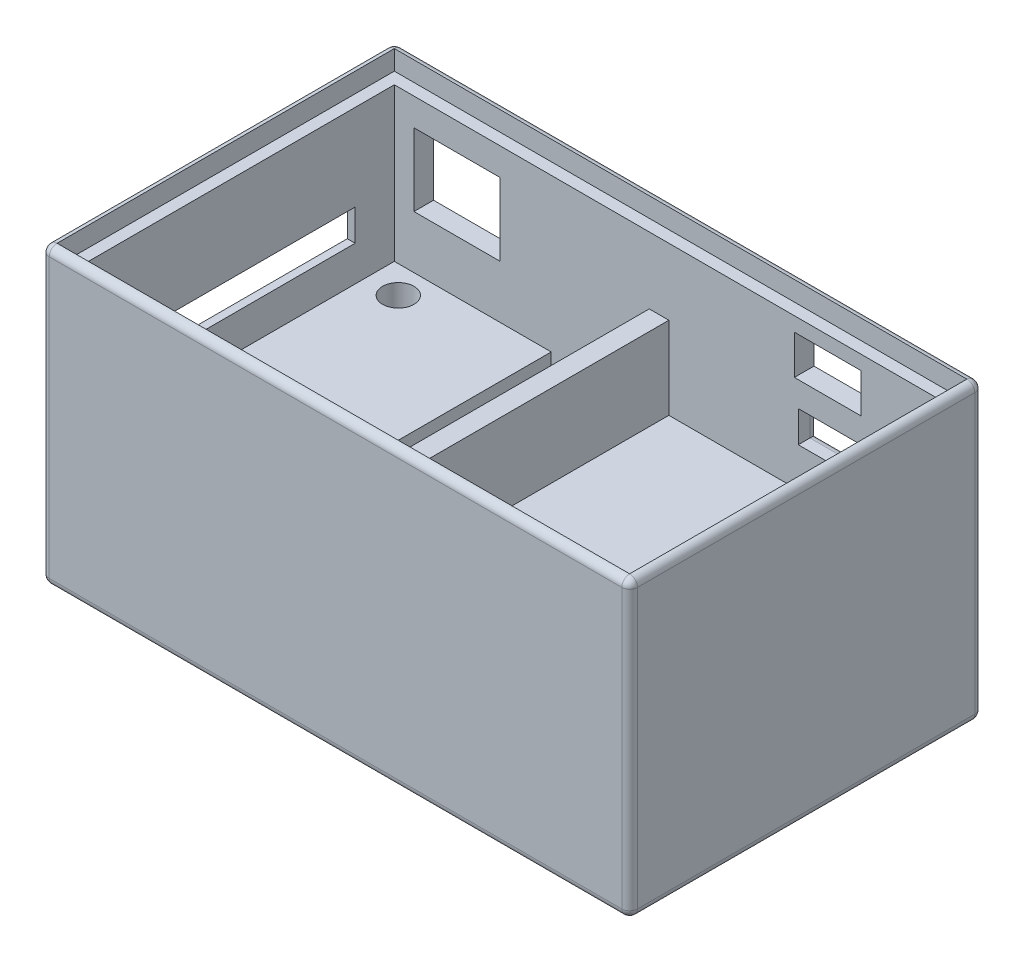
from build123d import *

# Parameters (mm, degrees)
SKETCH_2_W           = 150
SKETCH_2_H           = 90
EXTRUDE_1_DEPTH      = 75
SKETCH_3_W           = 140
SKETCH_3_H           = 80
CUT_EXTRUDE_2_DEPTH  = 72
SKETCH_6_W           = 5
SKETCH_6_H           = 80
EXTRUDE_2_DEPTH      = 50
EXTRUDE_3_REACH      = 190.016
SKETCH_8_W           = 70
SKETCH_8_H           = 3
CUT_EXTRUDE_3_REACH  = 143.863
SKETCH_9_W           = 20
SKETCH_9_H           = 10
CUT_EXTRUDE_4_REACH  = 190.016
SKETCH_10_W          = 70
SKETCH_10_H          = 26
SKETCH_11_W          = 75
SKETCH_11_H          = 30
CUT_EXTRUDE_5_DEPTH  = 5
SKETCH_12_W          = 15
SKETCH_12_H          = 8
CUT_EXTRUDE_6_DEPTH  = 5
FILLET_1_R           = 2
EXTRUDE_4_REACH      = 190.016
SKETCH_13_W          = 40
SKETCH_13_H          = 6
CUT_EXTRUDE_7_REACH  = 182.377
SKETCH_14_R          = 4
CUT_EXTRUDE_8_REACH  = 188.414
SKETCH_15_W          = 63
SKETCH_15_H          = 8
CUT_EXTRUDE_9_REACH  = 188.414
SKETCH_16_W          = 59.5
SKETCH_16_H          = 8
SKETCH_17_W          = 70
SKETCH_17_H          = 52
CUT_EXTRUDE_10_DEPTH = 3
CUT_EXTRUDE_11_REACH = 190.016
SKETCH_18_W          = 22
SKETCH_18_H          = 18.5
SKETCH_19_W          = 146
SKETCH_19_H          = 86
CUT_EXTRUDE_12_DEPTH = 5
CUT_EXTRUDE_13_REACH = 192.329
SKETCH_20_W          = 17
SKETCH_20_H          = 10


with BuildPart() as part:
    # 草图2 → 凸台-拉伸1 (new body)
    with BuildSketch(Plane(origin=(0, 0, 0), x_dir=(1, 0, 0), z_dir=(0, 1, 0))):
        with Locations((75, 45)):
            Rectangle(SKETCH_2_W, SKETCH_2_H)
    extrude(amount=EXTRUDE_1_DEPTH)

    # 草图3 → 切除-拉伸2 (cut)
    with BuildSketch(Plane(origin=(0, 75, 0), x_dir=(1, 0, 0), z_dir=(0, 1, 0))):
        with Locations((75, 45)):
            Rectangle(SKETCH_3_W, SKETCH_3_H)
    extrude(amount=-CUT_EXTRUDE_2_DEPTH, mode=Mode.SUBTRACT)

    # 草图6 → 凸台-拉伸2 (add)
    with BuildSketch(Plane(origin=(0, 3, 0), x_dir=(1, 0, 0), z_dir=(0, 1, 0))):
        with Locations((72.5, 45)):
            Rectangle(SKETCH_6_W, SKETCH_6_H)
    extrude(amount=EXTRUDE_2_DEPTH)

    # 草图8 → 凸台-拉伸3 (add, up to next)
    with BuildSketch(Plane.XY.offset(-85), mode=Mode.PRIVATE) as extrude_3_sk1:
        with Locations((110, 30.5)):
            Rectangle(SKETCH_8_W, SKETCH_8_H)
    extrude_3_tool1 = extrude(extrude_3_sk1.sketch, amount=EXTRUDE_3_REACH, mode=Mode.PRIVATE) - part.part
    add(extrude_3_tool1.solids().sort_by_distance((110, 30.5, -85))[0])

    # 草图9 → 切除-拉伸3 (cut, up to next)
    with BuildSketch(Plane.ZY.offset(-70), mode=Mode.PRIVATE) as cut_extrude_3_sk1:
        with Locations((-67, 8)):
            Rectangle(SKETCH_9_W, SKETCH_9_H)
    cut_extrude_3_tool1 = extrude(cut_extrude_3_sk1.sketch, amount=-CUT_EXTRUDE_3_REACH, mode=Mode.PRIVATE) & part.part
    add(cut_extrude_3_tool1.solids().sort_by_distance((70, 8, -67))[0], mode=Mode.SUBTRACT)

    # 草图10 → 切除-拉伸4 (cut, up to next)
    with BuildSketch(Plane.XY.offset(-85), mode=Mode.PRIVATE) as cut_extrude_4_sk1:
        with Locations((110, 16)):
            Rectangle(SKETCH_10_W, SKETCH_10_H)
    cut_extrude_4_tool1 = extrude(cut_extrude_4_sk1.sketch, amount=-CUT_EXTRUDE_4_REACH, mode=Mode.PRIVATE) & part.part
    add(cut_extrude_4_tool1.solids().sort_by_distance((110, 16, -85))[0], mode=Mode.SUBTRACT)

    # 草图11 → 切除-拉伸5 (cut)
    with BuildSketch(Plane(origin=(0, 0, -90), x_dir=(-1, 0, 0), z_dir=(0, 0, -1))):
        with Locations((-110, 16.5)):
            Rectangle(SKETCH_11_W, SKETCH_11_H)
    extrude(amount=-CUT_EXTRUDE_5_DEPTH, mode=Mode.SUBTRACT)

    # 草图12 → 切除-拉伸6 (cut)
    with BuildSketch(Plane.XY.offset(-85)):
        with Locations((115.5, 46)):
            Rectangle(SKETCH_12_W, SKETCH_12_H)
    extrude(amount=-CUT_EXTRUDE_6_DEPTH, mode=Mode.SUBTRACT)

    # 圆角1
    # the kernel refuses this fillet: 2 mm, written as the material it takes off along each edge
    with BuildSketch(Plane(origin=(148, 73, -2), x_dir=(1, 0, 0), z_dir=(0, 0, 1))) as fillet_1_piece_1_section:
        Polygon((0, 0), (FILLET_1_R * 1.02, 0), (FILLET_1_R * 1.02, FILLET_1_R * 1.02), (0, FILLET_1_R * 1.02), align=None)
    fillet_1_piece_1 = extrude(amount=FILLET_1_R * 1.02, mode=Mode.PRIVATE)
    fillet_1_piece_1 = fillet_1_piece_1 - Plane(origin=(148, 73, -2), x_dir=(-0.7071067811865475, -0.7071067811865475, 0), z_dir=(0, 0, 1)) * Sphere(FILLET_1_R, mode=Mode.PRIVATE)
    add(fillet_1_piece_1, mode=Mode.SUBTRACT)
    with BuildSketch(Plane(origin=(148, 73, -88), x_dir=(0, 1, 0), z_dir=(1, 0, 0))) as fillet_1_piece_2_section:
        Polygon((0, 0), (FILLET_1_R * 1.02, 0), (FILLET_1_R * 1.02, -FILLET_1_R * 1.02), (0, -FILLET_1_R * 1.02), align=None)
    fillet_1_piece_2 = extrude(amount=FILLET_1_R * 1.02, mode=Mode.PRIVATE)
    fillet_1_piece_2 = fillet_1_piece_2 - Plane(origin=(148, 73, -88), x_dir=(0, -0.7071067811865475, 0.7071067811865475), z_dir=(1, 0, 0)) * Sphere(FILLET_1_R, mode=Mode.PRIVATE)
    add(fillet_1_piece_2, mode=Mode.SUBTRACT)
    with BuildSketch(Plane(origin=(2, 73, -88), x_dir=(0, 1, 0), z_dir=(-1, 0, 0))) as fillet_1_piece_3_section:
        Polygon((0, 0), (FILLET_1_R * 1.02, 0), (FILLET_1_R * 1.02, FILLET_1_R * 1.02), (0, FILLET_1_R * 1.02), align=None)
    fillet_1_piece_3 = extrude(amount=FILLET_1_R * 1.02, mode=Mode.PRIVATE)
    fillet_1_piece_3 = fillet_1_piece_3 - Plane(origin=(2, 73, -88), x_dir=(0, -0.7071067811865475, 0.7071067811865475), z_dir=(-1, 0, 0)) * Sphere(FILLET_1_R, mode=Mode.PRIVATE)
    add(fillet_1_piece_3, mode=Mode.SUBTRACT)
    with BuildSketch(Plane(origin=(2, 73, -2), x_dir=(-1, 0, 0), z_dir=(0, 0, 1))) as fillet_1_piece_4_section:
        Polygon((0, 0), (FILLET_1_R * 1.02, 0), (FILLET_1_R * 1.02, -FILLET_1_R * 1.02), (0, -FILLET_1_R * 1.02), align=None)
    fillet_1_piece_4 = extrude(amount=FILLET_1_R * 1.02, mode=Mode.PRIVATE)
    fillet_1_piece_4 = fillet_1_piece_4 - Plane(origin=(2, 73, -2), x_dir=(0.7071067811865475, -0.7071067811865475, 0), z_dir=(0, 0, 1)) * Sphere(FILLET_1_R, mode=Mode.PRIVATE)
    add(fillet_1_piece_4, mode=Mode.SUBTRACT)
    with BuildSketch(Plane(origin=(148, 2, -88), x_dir=(0, -1, 0), z_dir=(1, 0, 0))) as fillet_1_piece_5_section:
        Polygon((0, 0), (FILLET_1_R * 1.02, 0), (FILLET_1_R * 1.02, FILLET_1_R * 1.02), (0, FILLET_1_R * 1.02), align=None)
    fillet_1_piece_5 = extrude(amount=FILLET_1_R * 1.02, mode=Mode.PRIVATE)
    fillet_1_piece_5 = fillet_1_piece_5 - Plane(origin=(148, 2, -88), x_dir=(0, 0.7071067811865475, 0.7071067811865475), z_dir=(1, 0, 0)) * Sphere(FILLET_1_R, mode=Mode.PRIVATE)
    add(fillet_1_piece_5, mode=Mode.SUBTRACT)
    with BuildSketch(Plane(origin=(2, 2, -88), x_dir=(0, -1, 0), z_dir=(-1, 0, 0))) as fillet_1_piece_6_section:
        Polygon((0, 0), (FILLET_1_R * 1.02, 0), (FILLET_1_R * 1.02, -FILLET_1_R * 1.02), (0, -FILLET_1_R * 1.02), align=None)
    fillet_1_piece_6 = extrude(amount=FILLET_1_R * 1.02, mode=Mode.PRIVATE)
    fillet_1_piece_6 = fillet_1_piece_6 - Plane(origin=(2, 2, -88), x_dir=(0, 0.7071067811865475, 0.7071067811865475), z_dir=(-1, 0, 0)) * Sphere(FILLET_1_R, mode=Mode.PRIVATE)
    add(fillet_1_piece_6, mode=Mode.SUBTRACT)
    with BuildSketch(Plane(origin=(148, 2, -2), x_dir=(1, 0, 0), z_dir=(0, 0, 1))) as fillet_1_piece_7_section:
        Polygon((0, 0), (FILLET_1_R * 1.02, 0), (FILLET_1_R * 1.02, -FILLET_1_R * 1.02), (0, -FILLET_1_R * 1.02), align=None)
    fillet_1_piece_7 = extrude(amount=FILLET_1_R * 1.02, mode=Mode.PRIVATE)
    fillet_1_piece_7 = fillet_1_piece_7 - Plane(origin=(148, 2, -2), x_dir=(-0.7071067811865475, 0.7071067811865475, 0), z_dir=(0, 0, 1)) * Sphere(FILLET_1_R, mode=Mode.PRIVATE)
    add(fillet_1_piece_7, mode=Mode.SUBTRACT)
    with BuildSketch(Plane(origin=(2, 2, -2), x_dir=(-1, 0, 0), z_dir=(0, 0, 1))) as fillet_1_piece_8_section:
        Polygon((0, 0), (FILLET_1_R * 1.02, 0), (FILLET_1_R * 1.02, FILLET_1_R * 1.02), (0, FILLET_1_R * 1.02), align=None)
    fillet_1_piece_8 = extrude(amount=FILLET_1_R * 1.02, mode=Mode.PRIVATE)
    fillet_1_piece_8 = fillet_1_piece_8 - Plane(origin=(2, 2, -2), x_dir=(0.7071067811865475, 0.7071067811865475, 0), z_dir=(0, 0, 1)) * Sphere(FILLET_1_R, mode=Mode.PRIVATE)
    add(fillet_1_piece_8, mode=Mode.SUBTRACT)
    with BuildSketch(Plane(origin=(147.5, 1.5, -90), x_dir=(1, 0, 0), z_dir=(0, 1, 0)), Plane(origin=(72.5, 31.5, -90), x_dir=(-1, 0, 0), z_dir=(0, -1, 0))) as fillet_1_piece_9:
        with BuildLine():
            CenterArc((FILLET_1_R, -FILLET_1_R), FILLET_1_R, 90, 90)
            Line((0, -FILLET_1_R), (-FILLET_1_R * 0.02, -FILLET_1_R))
            Line((-FILLET_1_R * 0.02, -FILLET_1_R), (-FILLET_1_R * 0.02, FILLET_1_R * 0.02))
            Line((-FILLET_1_R * 0.02, FILLET_1_R * 0.02), (FILLET_1_R, FILLET_1_R * 0.02))
            Line((FILLET_1_R, FILLET_1_R * 0.02), (FILLET_1_R, 0))
        make_face()
    extrude(amount=30, mode=Mode.SUBTRACT)
    with BuildSketch(Plane(origin=(72.5, 1.5, -90), x_dir=(0, -1, 0), z_dir=(1, 0, 0)), Plane(origin=(147.5, 31.5, -90), x_dir=(0, 1, 0), z_dir=(-1, 0, 0))) as fillet_1_piece_10:
        with BuildLine():
            CenterArc((FILLET_1_R, -FILLET_1_R), FILLET_1_R, 90, 90)
            Line((0, -FILLET_1_R), (-FILLET_1_R * 0.02, -FILLET_1_R))
            Line((-FILLET_1_R * 0.02, -FILLET_1_R), (-FILLET_1_R * 0.02, FILLET_1_R * 0.02))
            Line((-FILLET_1_R * 0.02, FILLET_1_R * 0.02), (FILLET_1_R, FILLET_1_R * 0.02))
            Line((FILLET_1_R, FILLET_1_R * 0.02), (FILLET_1_R, 0))
        make_face()
    extrude(amount=75, mode=Mode.SUBTRACT)
    with BuildSketch(Plane(origin=(108, 42, -90), x_dir=(-1, 0, 0), z_dir=(0, 1, 0)), Plane(origin=(123, 50, -90), x_dir=(1, 0, 0), z_dir=(0, -1, 0))) as fillet_1_piece_11:
        with BuildLine():
            CenterArc((FILLET_1_R, FILLET_1_R), FILLET_1_R, 180, 90)
            Line((0, FILLET_1_R), (-FILLET_1_R * 0.02, FILLET_1_R))
            Line((-FILLET_1_R * 0.02, FILLET_1_R), (-FILLET_1_R * 0.02, -FILLET_1_R * 0.02))
            Line((-FILLET_1_R * 0.02, -FILLET_1_R * 0.02), (FILLET_1_R, -FILLET_1_R * 0.02))
            Line((FILLET_1_R, -FILLET_1_R * 0.02), (FILLET_1_R, 0))
        make_face()
    extrude(amount=8, mode=Mode.SUBTRACT)
    with BuildSketch(Plane(origin=(108, 50, -90), x_dir=(0, 1, 0), z_dir=(1, 0, 0)), Plane(origin=(123, 42, -90), x_dir=(0, -1, 0), z_dir=(-1, 0, 0))) as fillet_1_piece_12:
        with BuildLine():
            CenterArc((FILLET_1_R, FILLET_1_R), FILLET_1_R, 180, 90)
            Line((0, FILLET_1_R), (-FILLET_1_R * 0.02, FILLET_1_R))
            Line((-FILLET_1_R * 0.02, FILLET_1_R), (-FILLET_1_R * 0.02, -FILLET_1_R * 0.02))
            Line((-FILLET_1_R * 0.02, -FILLET_1_R * 0.02), (FILLET_1_R, -FILLET_1_R * 0.02))
            Line((FILLET_1_R, -FILLET_1_R * 0.02), (FILLET_1_R, 0))
        make_face()
    extrude(amount=15, mode=Mode.SUBTRACT)
    with BuildSketch(Plane(origin=(150, 75, -2), x_dir=(0, -1, 0), z_dir=(0, 0, -1)), Plane(origin=(0, 75, -88), x_dir=(0, -1, 0), z_dir=(0, 0, 1))) as fillet_1_piece_13:
        with BuildLine():
            CenterArc((FILLET_1_R, FILLET_1_R), FILLET_1_R, 180, 90)
            Line((0, FILLET_1_R), (-FILLET_1_R * 0.02, FILLET_1_R))
            Line((-FILLET_1_R * 0.02, FILLET_1_R), (-FILLET_1_R * 0.02, -FILLET_1_R * 0.02))
            Line((-FILLET_1_R * 0.02, -FILLET_1_R * 0.02), (FILLET_1_R, -FILLET_1_R * 0.02))
            Line((FILLET_1_R, -FILLET_1_R * 0.02), (FILLET_1_R, 0))
        make_face()
    extrude(amount=86, mode=Mode.SUBTRACT)
    with BuildSketch(Plane(origin=(148, 75, -90), x_dir=(0, 0, 1), z_dir=(-1, 0, 0)), Plane(origin=(2, 0, 0), x_dir=(0, 1, 0), z_dir=(1, 0, 0))) as fillet_1_piece_14:
        with BuildLine():
            CenterArc((FILLET_1_R, -FILLET_1_R), FILLET_1_R, 90, 90)
            Line((0, -FILLET_1_R), (-FILLET_1_R * 0.02, -FILLET_1_R))
            Line((-FILLET_1_R * 0.02, -FILLET_1_R), (-FILLET_1_R * 0.02, FILLET_1_R * 0.02))
            Line((-FILLET_1_R * 0.02, FILLET_1_R * 0.02), (FILLET_1_R, FILLET_1_R * 0.02))
            Line((FILLET_1_R, FILLET_1_R * 0.02), (FILLET_1_R, 0))
        make_face()
    extrude(amount=146, mode=Mode.SUBTRACT)
    with BuildSketch(Plane(origin=(148, 0, -90), x_dir=(0, 0, 1), z_dir=(-1, 0, 0)), Plane(origin=(2, 75, 0), x_dir=(0, -1, 0), z_dir=(1, 0, 0))) as fillet_1_piece_15:
        with BuildLine():
            CenterArc((FILLET_1_R, FILLET_1_R), FILLET_1_R, 180, 90)
            Line((0, FILLET_1_R), (-FILLET_1_R * 0.02, FILLET_1_R))
            Line((-FILLET_1_R * 0.02, FILLET_1_R), (-FILLET_1_R * 0.02, -FILLET_1_R * 0.02))
            Line((-FILLET_1_R * 0.02, -FILLET_1_R * 0.02), (FILLET_1_R, -FILLET_1_R * 0.02))
            Line((FILLET_1_R, -FILLET_1_R * 0.02), (FILLET_1_R, 0))
        make_face()
    extrude(amount=146, mode=Mode.SUBTRACT)
    with BuildSketch(Plane(origin=(150, 0, -2), x_dir=(0, 1, 0), z_dir=(0, 0, -1)), Plane(origin=(0, 0, -88), x_dir=(0, 1, 0), z_dir=(0, 0, 1))) as fillet_1_piece_16:
        with BuildLine():
            CenterArc((FILLET_1_R, -FILLET_1_R), FILLET_1_R, 90, 90)
            Line((0, -FILLET_1_R), (-FILLET_1_R * 0.02, -FILLET_1_R))
            Line((-FILLET_1_R * 0.02, -FILLET_1_R), (-FILLET_1_R * 0.02, FILLET_1_R * 0.02))
            Line((-FILLET_1_R * 0.02, FILLET_1_R * 0.02), (FILLET_1_R, FILLET_1_R * 0.02))
            Line((FILLET_1_R, FILLET_1_R * 0.02), (FILLET_1_R, 0))
        make_face()
    extrude(amount=86, mode=Mode.SUBTRACT)
    with BuildSketch(Plane(origin=(0, 2, -90), x_dir=(0, 0, 1), z_dir=(0, 1, 0)), Plane(origin=(0, 2, 0), x_dir=(1, 0, 0), z_dir=(0, 1, 0))) as fillet_1_piece_17:
        with BuildLine():
            CenterArc((FILLET_1_R, FILLET_1_R), FILLET_1_R, 180, 90)
            Line((0, FILLET_1_R), (-FILLET_1_R * 0.02, FILLET_1_R))
            Line((-FILLET_1_R * 0.02, FILLET_1_R), (-FILLET_1_R * 0.02, -FILLET_1_R * 0.02))
            Line((-FILLET_1_R * 0.02, -FILLET_1_R * 0.02), (FILLET_1_R, -FILLET_1_R * 0.02))
            Line((FILLET_1_R, -FILLET_1_R * 0.02), (FILLET_1_R, 0))
        make_face()
    extrude(amount=71, mode=Mode.SUBTRACT)
    with BuildSketch(Plane(origin=(150, 2, -90), x_dir=(0, 0, 1), z_dir=(0, 1, 0)), Plane(origin=(150, 2, 0), x_dir=(-1, 0, 0), z_dir=(0, 1, 0))) as fillet_1_piece_18:
        with BuildLine():
            CenterArc((FILLET_1_R, -FILLET_1_R), FILLET_1_R, 90, 90)
            Line((0, -FILLET_1_R), (-FILLET_1_R * 0.02, -FILLET_1_R))
            Line((-FILLET_1_R * 0.02, -FILLET_1_R), (-FILLET_1_R * 0.02, FILLET_1_R * 0.02))
            Line((-FILLET_1_R * 0.02, FILLET_1_R * 0.02), (FILLET_1_R, FILLET_1_R * 0.02))
            Line((FILLET_1_R, FILLET_1_R * 0.02), (FILLET_1_R, 0))
        make_face()
    extrude(amount=71, mode=Mode.SUBTRACT)
    with BuildSketch(Plane(origin=(147.5, -3.5, -90), x_dir=(1, 0, 0), z_dir=(0, 1, 0))) as fillet_1_piece_19a_section:
        with BuildLine():
            CenterArc((FILLET_1_R, -FILLET_1_R), FILLET_1_R, 90, 90)
            Line((0, -FILLET_1_R), (-FILLET_1_R * 0.02, -FILLET_1_R))
            Line((-FILLET_1_R * 0.02, -FILLET_1_R), (-FILLET_1_R * 0.02, FILLET_1_R * 0.02))
            Line((-FILLET_1_R * 0.02, FILLET_1_R * 0.02), (FILLET_1_R, FILLET_1_R * 0.02))
            Line((FILLET_1_R, FILLET_1_R * 0.02), (FILLET_1_R, 0))
        make_face()
    fillet_1_piece_19a = extrude(amount=35, mode=Mode.PRIVATE)
    fillet_1_piece_19a = split(fillet_1_piece_19a, bisect_by=Plane(origin=(147.952790229, 1.5, -89.547209771), z_dir=(0, -1, 0)), keep=Keep.TOP, mode=Mode.PRIVATE)
    with BuildSketch(Plane(origin=(72.5, 1.5, -90), x_dir=(0, -1, 0), z_dir=(1, 0, 0))) as fillet_1_piece_19b_section:
        with BuildLine():
            CenterArc((FILLET_1_R, -FILLET_1_R), FILLET_1_R, 90, 90)
            Line((0, -FILLET_1_R), (-FILLET_1_R * 0.02, -FILLET_1_R))
            Line((-FILLET_1_R * 0.02, -FILLET_1_R), (-FILLET_1_R * 0.02, FILLET_1_R * 0.02))
            Line((-FILLET_1_R * 0.02, FILLET_1_R * 0.02), (FILLET_1_R, FILLET_1_R * 0.02))
            Line((FILLET_1_R, FILLET_1_R * 0.02), (FILLET_1_R, 0))
        make_face()
    fillet_1_piece_19b = extrude(amount=80, mode=Mode.PRIVATE)
    fillet_1_piece_19b = split(fillet_1_piece_19b, bisect_by=Plane(origin=(147.5, 1.047209771, -89.547209771), z_dir=(1, 0, 0)), keep=Keep.TOP, mode=Mode.PRIVATE)
    fillet_1_piece_19 = fillet_1_piece_19a & fillet_1_piece_19b
    add(fillet_1_piece_19, mode=Mode.SUBTRACT)
    with BuildSketch(Plane(origin=(152.5, 31.5, -90), x_dir=(0, 1, 0), z_dir=(-1, 0, 0))) as fillet_1_piece_20a_section:
        with BuildLine():
            CenterArc((FILLET_1_R, -FILLET_1_R), FILLET_1_R, 90, 90)
            Line((0, -FILLET_1_R), (-FILLET_1_R * 0.02, -FILLET_1_R))
            Line((-FILLET_1_R * 0.02, -FILLET_1_R), (-FILLET_1_R * 0.02, FILLET_1_R * 0.02))
            Line((-FILLET_1_R * 0.02, FILLET_1_R * 0.02), (FILLET_1_R, FILLET_1_R * 0.02))
            Line((FILLET_1_R, FILLET_1_R * 0.02), (FILLET_1_R, 0))
        make_face()
    fillet_1_piece_20a = extrude(amount=80, mode=Mode.PRIVATE)
    fillet_1_piece_20a = split(fillet_1_piece_20a, bisect_by=Plane(origin=(147.5, 31.952790229, -89.547209771), z_dir=(1, 0, 0)), keep=Keep.TOP, mode=Mode.PRIVATE)
    with BuildSketch(Plane(origin=(147.5, 1.5, -90), x_dir=(1, 0, 0), z_dir=(0, 1, 0))) as fillet_1_piece_20b_section:
        with BuildLine():
            CenterArc((FILLET_1_R, -FILLET_1_R), FILLET_1_R, 90, 90)
            Line((0, -FILLET_1_R), (-FILLET_1_R * 0.02, -FILLET_1_R))
            Line((-FILLET_1_R * 0.02, -FILLET_1_R), (-FILLET_1_R * 0.02, FILLET_1_R * 0.02))
            Line((-FILLET_1_R * 0.02, FILLET_1_R * 0.02), (FILLET_1_R, FILLET_1_R * 0.02))
            Line((FILLET_1_R, FILLET_1_R * 0.02), (FILLET_1_R, 0))
        make_face()
    fillet_1_piece_20b = extrude(amount=35, mode=Mode.PRIVATE)
    fillet_1_piece_20b = split(fillet_1_piece_20b, bisect_by=Plane(origin=(147.952790229, 31.5, -89.547209771), z_dir=(0, 1, 0)), keep=Keep.TOP, mode=Mode.PRIVATE)
    fillet_1_piece_20 = fillet_1_piece_20a & fillet_1_piece_20b
    add(fillet_1_piece_20, mode=Mode.SUBTRACT)
    with BuildSketch(Plane(origin=(72.5, 31.5, -90), x_dir=(-1, 0, 0), z_dir=(0, -1, 0))) as fillet_1_piece_21a_section:
        with BuildLine():
            CenterArc((FILLET_1_R, -FILLET_1_R), FILLET_1_R, 90, 90)
            Line((0, -FILLET_1_R), (-FILLET_1_R * 0.02, -FILLET_1_R))
            Line((-FILLET_1_R * 0.02, -FILLET_1_R), (-FILLET_1_R * 0.02, FILLET_1_R * 0.02))
            Line((-FILLET_1_R * 0.02, FILLET_1_R * 0.02), (FILLET_1_R, FILLET_1_R * 0.02))
            Line((FILLET_1_R, FILLET_1_R * 0.02), (FILLET_1_R, 0))
        make_face()
    fillet_1_piece_21a = extrude(amount=35, mode=Mode.PRIVATE)
    fillet_1_piece_21a = split(fillet_1_piece_21a, bisect_by=Plane(origin=(72.047209771, 1.5, -89.547209771), z_dir=(0, -1, 0)), keep=Keep.TOP, mode=Mode.PRIVATE)
    with BuildSketch(Plane(origin=(67.5, 1.5, -90), x_dir=(0, -1, 0), z_dir=(1, 0, 0))) as fillet_1_piece_21b_section:
        with BuildLine():
            CenterArc((FILLET_1_R, -FILLET_1_R), FILLET_1_R, 90, 90)
            Line((0, -FILLET_1_R), (-FILLET_1_R * 0.02, -FILLET_1_R))
            Line((-FILLET_1_R * 0.02, -FILLET_1_R), (-FILLET_1_R * 0.02, FILLET_1_R * 0.02))
            Line((-FILLET_1_R * 0.02, FILLET_1_R * 0.02), (FILLET_1_R, FILLET_1_R * 0.02))
            Line((FILLET_1_R, FILLET_1_R * 0.02), (FILLET_1_R, 0))
        make_face()
    fillet_1_piece_21b = extrude(amount=80, mode=Mode.PRIVATE)
    fillet_1_piece_21b = split(fillet_1_piece_21b, bisect_by=Plane(origin=(72.5, 1.047209771, -89.547209771), z_dir=(-1, 0, 0)), keep=Keep.TOP, mode=Mode.PRIVATE)
    fillet_1_piece_21 = fillet_1_piece_21a & fillet_1_piece_21b
    add(fillet_1_piece_21, mode=Mode.SUBTRACT)
    with BuildSketch(Plane(origin=(147.5, 31.5, -90), x_dir=(0, 1, 0), z_dir=(-1, 0, 0))) as fillet_1_piece_22a_section:
        with BuildLine():
            CenterArc((FILLET_1_R, -FILLET_1_R), FILLET_1_R, 90, 90)
            Line((0, -FILLET_1_R), (-FILLET_1_R * 0.02, -FILLET_1_R))
            Line((-FILLET_1_R * 0.02, -FILLET_1_R), (-FILLET_1_R * 0.02, FILLET_1_R * 0.02))
            Line((-FILLET_1_R * 0.02, FILLET_1_R * 0.02), (FILLET_1_R, FILLET_1_R * 0.02))
            Line((FILLET_1_R, FILLET_1_R * 0.02), (FILLET_1_R, 0))
        make_face()
    fillet_1_piece_22a = extrude(amount=80, mode=Mode.PRIVATE)
    fillet_1_piece_22a = split(fillet_1_piece_22a, bisect_by=Plane(origin=(72.5, 31.952790229, -89.547209771), z_dir=(-1, 0, 0)), keep=Keep.TOP, mode=Mode.PRIVATE)
    with BuildSketch(Plane(origin=(72.5, 36.5, -90), x_dir=(-1, 0, 0), z_dir=(0, -1, 0))) as fillet_1_piece_22b_section:
        with BuildLine():
            CenterArc((FILLET_1_R, -FILLET_1_R), FILLET_1_R, 90, 90)
            Line((0, -FILLET_1_R), (-FILLET_1_R * 0.02, -FILLET_1_R))
            Line((-FILLET_1_R * 0.02, -FILLET_1_R), (-FILLET_1_R * 0.02, FILLET_1_R * 0.02))
            Line((-FILLET_1_R * 0.02, FILLET_1_R * 0.02), (FILLET_1_R, FILLET_1_R * 0.02))
            Line((FILLET_1_R, FILLET_1_R * 0.02), (FILLET_1_R, 0))
        make_face()
    fillet_1_piece_22b = extrude(amount=35, mode=Mode.PRIVATE)
    fillet_1_piece_22b = split(fillet_1_piece_22b, bisect_by=Plane(origin=(72.047209771, 31.5, -89.547209771), z_dir=(0, 1, 0)), keep=Keep.TOP, mode=Mode.PRIVATE)
    fillet_1_piece_22 = fillet_1_piece_22a & fillet_1_piece_22b
    add(fillet_1_piece_22, mode=Mode.SUBTRACT)
    with BuildSketch(Plane(origin=(108, 37, -90), x_dir=(-1, 0, 0), z_dir=(0, 1, 0))) as fillet_1_piece_23a_section:
        with BuildLine():
            CenterArc((FILLET_1_R, FILLET_1_R), FILLET_1_R, 180, 90)
            Line((0, FILLET_1_R), (-FILLET_1_R * 0.02, FILLET_1_R))
            Line((-FILLET_1_R * 0.02, FILLET_1_R), (-FILLET_1_R * 0.02, -FILLET_1_R * 0.02))
            Line((-FILLET_1_R * 0.02, -FILLET_1_R * 0.02), (FILLET_1_R, -FILLET_1_R * 0.02))
            Line((FILLET_1_R, -FILLET_1_R * 0.02), (FILLET_1_R, 0))
        make_face()
    fillet_1_piece_23a = extrude(amount=13, mode=Mode.PRIVATE)
    fillet_1_piece_23a = split(fillet_1_piece_23a, bisect_by=Plane(origin=(107.547209771, 42, -89.547209771), z_dir=(0, -1, 0)), keep=Keep.TOP, mode=Mode.PRIVATE)
    with BuildSketch(Plane(origin=(123, 42, -90), x_dir=(0, -1, 0), z_dir=(-1, 0, 0))) as fillet_1_piece_23b_section:
        with BuildLine():
            CenterArc((FILLET_1_R, FILLET_1_R), FILLET_1_R, 180, 90)
            Line((0, FILLET_1_R), (-FILLET_1_R * 0.02, FILLET_1_R))
            Line((-FILLET_1_R * 0.02, FILLET_1_R), (-FILLET_1_R * 0.02, -FILLET_1_R * 0.02))
            Line((-FILLET_1_R * 0.02, -FILLET_1_R * 0.02), (FILLET_1_R, -FILLET_1_R * 0.02))
            Line((FILLET_1_R, -FILLET_1_R * 0.02), (FILLET_1_R, 0))
        make_face()
    fillet_1_piece_23b = extrude(amount=20, mode=Mode.PRIVATE)
    fillet_1_piece_23b = split(fillet_1_piece_23b, bisect_by=Plane(origin=(108, 41.547209771, -89.547209771), z_dir=(-1, 0, 0)), keep=Keep.TOP, mode=Mode.PRIVATE)
    fillet_1_piece_23 = fillet_1_piece_23a & fillet_1_piece_23b
    add(fillet_1_piece_23, mode=Mode.SUBTRACT)
    with BuildSketch(Plane(origin=(108, 42, -90), x_dir=(-1, 0, 0), z_dir=(0, 1, 0))) as fillet_1_piece_24a_section:
        with BuildLine():
            CenterArc((FILLET_1_R, FILLET_1_R), FILLET_1_R, 180, 90)
            Line((0, FILLET_1_R), (-FILLET_1_R * 0.02, FILLET_1_R))
            Line((-FILLET_1_R * 0.02, FILLET_1_R), (-FILLET_1_R * 0.02, -FILLET_1_R * 0.02))
            Line((-FILLET_1_R * 0.02, -FILLET_1_R * 0.02), (FILLET_1_R, -FILLET_1_R * 0.02))
            Line((FILLET_1_R, -FILLET_1_R * 0.02), (FILLET_1_R, 0))
        make_face()
    fillet_1_piece_24a = extrude(amount=13, mode=Mode.PRIVATE)
    fillet_1_piece_24a = split(fillet_1_piece_24a, bisect_by=Plane(origin=(107.547209771, 50, -89.547209771), z_dir=(0, 1, 0)), keep=Keep.TOP, mode=Mode.PRIVATE)
    with BuildSketch(Plane(origin=(103, 50, -90), x_dir=(0, 1, 0), z_dir=(1, 0, 0))) as fillet_1_piece_24b_section:
        with BuildLine():
            CenterArc((FILLET_1_R, FILLET_1_R), FILLET_1_R, 180, 90)
            Line((0, FILLET_1_R), (-FILLET_1_R * 0.02, FILLET_1_R))
            Line((-FILLET_1_R * 0.02, FILLET_1_R), (-FILLET_1_R * 0.02, -FILLET_1_R * 0.02))
            Line((-FILLET_1_R * 0.02, -FILLET_1_R * 0.02), (FILLET_1_R, -FILLET_1_R * 0.02))
            Line((FILLET_1_R, -FILLET_1_R * 0.02), (FILLET_1_R, 0))
        make_face()
    fillet_1_piece_24b = extrude(amount=20, mode=Mode.PRIVATE)
    fillet_1_piece_24b = split(fillet_1_piece_24b, bisect_by=Plane(origin=(108, 50.452790229, -89.547209771), z_dir=(-1, 0, 0)), keep=Keep.TOP, mode=Mode.PRIVATE)
    fillet_1_piece_24 = fillet_1_piece_24a & fillet_1_piece_24b
    add(fillet_1_piece_24, mode=Mode.SUBTRACT)
    with BuildSketch(Plane(origin=(123, 55, -90), x_dir=(1, 0, 0), z_dir=(0, -1, 0))) as fillet_1_piece_25a_section:
        with BuildLine():
            CenterArc((FILLET_1_R, FILLET_1_R), FILLET_1_R, 180, 90)
            Line((0, FILLET_1_R), (-FILLET_1_R * 0.02, FILLET_1_R))
            Line((-FILLET_1_R * 0.02, FILLET_1_R), (-FILLET_1_R * 0.02, -FILLET_1_R * 0.02))
            Line((-FILLET_1_R * 0.02, -FILLET_1_R * 0.02), (FILLET_1_R, -FILLET_1_R * 0.02))
            Line((FILLET_1_R, -FILLET_1_R * 0.02), (FILLET_1_R, 0))
        make_face()
    fillet_1_piece_25a = extrude(amount=13, mode=Mode.PRIVATE)
    fillet_1_piece_25a = split(fillet_1_piece_25a, bisect_by=Plane(origin=(123.452790229, 50, -89.547209771), z_dir=(0, 1, 0)), keep=Keep.TOP, mode=Mode.PRIVATE)
    with BuildSketch(Plane(origin=(108, 50, -90), x_dir=(0, 1, 0), z_dir=(1, 0, 0))) as fillet_1_piece_25b_section:
        with BuildLine():
            CenterArc((FILLET_1_R, FILLET_1_R), FILLET_1_R, 180, 90)
            Line((0, FILLET_1_R), (-FILLET_1_R * 0.02, FILLET_1_R))
            Line((-FILLET_1_R * 0.02, FILLET_1_R), (-FILLET_1_R * 0.02, -FILLET_1_R * 0.02))
            Line((-FILLET_1_R * 0.02, -FILLET_1_R * 0.02), (FILLET_1_R, -FILLET_1_R * 0.02))
            Line((FILLET_1_R, -FILLET_1_R * 0.02), (FILLET_1_R, 0))
        make_face()
    fillet_1_piece_25b = extrude(amount=20, mode=Mode.PRIVATE)
    fillet_1_piece_25b = split(fillet_1_piece_25b, bisect_by=Plane(origin=(123, 50.452790229, -89.547209771), z_dir=(1, 0, 0)), keep=Keep.TOP, mode=Mode.PRIVATE)
    fillet_1_piece_25 = fillet_1_piece_25a & fillet_1_piece_25b
    add(fillet_1_piece_25, mode=Mode.SUBTRACT)
    with BuildSketch(Plane(origin=(128, 42, -90), x_dir=(0, -1, 0), z_dir=(-1, 0, 0))) as fillet_1_piece_26a_section:
        with BuildLine():
            CenterArc((FILLET_1_R, FILLET_1_R), FILLET_1_R, 180, 90)
            Line((0, FILLET_1_R), (-FILLET_1_R * 0.02, FILLET_1_R))
            Line((-FILLET_1_R * 0.02, FILLET_1_R), (-FILLET_1_R * 0.02, -FILLET_1_R * 0.02))
            Line((-FILLET_1_R * 0.02, -FILLET_1_R * 0.02), (FILLET_1_R, -FILLET_1_R * 0.02))
            Line((FILLET_1_R, -FILLET_1_R * 0.02), (FILLET_1_R, 0))
        make_face()
    fillet_1_piece_26a = extrude(amount=20, mode=Mode.PRIVATE)
    fillet_1_piece_26a = split(fillet_1_piece_26a, bisect_by=Plane(origin=(123, 41.547209771, -89.547209771), z_dir=(1, 0, 0)), keep=Keep.TOP, mode=Mode.PRIVATE)
    with BuildSketch(Plane(origin=(123, 50, -90), x_dir=(1, 0, 0), z_dir=(0, -1, 0))) as fillet_1_piece_26b_section:
        with BuildLine():
            CenterArc((FILLET_1_R, FILLET_1_R), FILLET_1_R, 180, 90)
            Line((0, FILLET_1_R), (-FILLET_1_R * 0.02, FILLET_1_R))
            Line((-FILLET_1_R * 0.02, FILLET_1_R), (-FILLET_1_R * 0.02, -FILLET_1_R * 0.02))
            Line((-FILLET_1_R * 0.02, -FILLET_1_R * 0.02), (FILLET_1_R, -FILLET_1_R * 0.02))
            Line((FILLET_1_R, -FILLET_1_R * 0.02), (FILLET_1_R, 0))
        make_face()
    fillet_1_piece_26b = extrude(amount=13, mode=Mode.PRIVATE)
    fillet_1_piece_26b = split(fillet_1_piece_26b, bisect_by=Plane(origin=(123.452790229, 42, -89.547209771), z_dir=(0, -1, 0)), keep=Keep.TOP, mode=Mode.PRIVATE)
    fillet_1_piece_26 = fillet_1_piece_26a & fillet_1_piece_26b
    add(fillet_1_piece_26, mode=Mode.SUBTRACT)

    # 草图13 → 凸台-拉伸4 (add, up to next)
    with BuildSketch(Plane.XY.offset(-85), mode=Mode.PRIVATE) as extrude_4_sk1:
        with Locations((25, 28)):
            Rectangle(SKETCH_13_W, SKETCH_13_H)
    extrude_4_tool1 = extrude(extrude_4_sk1.sketch, amount=EXTRUDE_4_REACH, mode=Mode.PRIVATE) - part.part
    add(extrude_4_tool1.solids().sort_by_distance((25, 28, -85))[0])

    # 草图14 → 切除-拉伸7 (cut, up to next)
    with BuildSketch(Plane(origin=(0, 31, 0), x_dir=(1, 0, 0), z_dir=(0, 1, 0)), mode=Mode.PRIVATE) as cut_extrude_7_sk1:
        with Locations(Location((13, 78, 0), (0, 0, 270))):
            Circle(SKETCH_14_R)
    cut_extrude_7_tool1 = extrude(cut_extrude_7_sk1.sketch, amount=-CUT_EXTRUDE_7_REACH, mode=Mode.PRIVATE) & part.part
    # 草图14 → 切除-拉伸7 (cut, up to next)
    with BuildSketch(Plane(origin=(0, 31, 0), x_dir=(1, 0, 0), z_dir=(0, 1, 0)), mode=Mode.PRIVATE) as cut_extrude_7_sk2:
        with Locations(Location((13, 18, 0), (0, 0, 270))):
            Circle(SKETCH_14_R)
    cut_extrude_7_tool2 = extrude(cut_extrude_7_sk2.sketch, amount=-CUT_EXTRUDE_7_REACH, mode=Mode.PRIVATE) & part.part
    add(cut_extrude_7_tool1.solids().sort_by_distance((13, 31, -78))[0], mode=Mode.SUBTRACT)
    add(cut_extrude_7_tool2.solids().sort_by_distance((13, 31, -18))[0], mode=Mode.SUBTRACT)

    # 草图15 → 切除-拉伸8 (cut, up to next)
    with BuildSketch(Plane(origin=(5, 0, 0), x_dir=(0, 0, -1), z_dir=(1, 0, 0)), mode=Mode.PRIVATE) as cut_extrude_8_sk1:
        with Locations((49.5, 8)):
            Rectangle(SKETCH_15_W, SKETCH_15_H)
    cut_extrude_8_tool1 = extrude(cut_extrude_8_sk1.sketch, amount=-CUT_EXTRUDE_8_REACH, mode=Mode.PRIVATE) & part.part
    add(cut_extrude_8_tool1.solids().sort_by_distance((5, 8, -49.5))[0], mode=Mode.SUBTRACT)

    # 草图16 → 切除-拉伸9 (cut, up to next)
    with BuildSketch(Plane(origin=(5, 0, 0), x_dir=(0, 0, -1), z_dir=(1, 0, 0)), mode=Mode.PRIVATE) as cut_extrude_9_sk1:
        with Locations((45.25, 44)):
            Rectangle(SKETCH_16_W, SKETCH_16_H)
    cut_extrude_9_tool1 = extrude(cut_extrude_9_sk1.sketch, amount=-CUT_EXTRUDE_9_REACH, mode=Mode.PRIVATE) & part.part
    add(cut_extrude_9_tool1.solids().sort_by_distance((5, 44, -45.25))[0], mode=Mode.SUBTRACT)

    # 草图17 → 切除-拉伸10 (cut)
    with BuildSketch(Plane.ZY):
        with Locations((-50.4, 30)):
            Rectangle(SKETCH_17_W, SKETCH_17_H)
    extrude(amount=-CUT_EXTRUDE_10_DEPTH, mode=Mode.SUBTRACT)

    # 草图18 → 切除-拉伸11 (cut, up to next)
    with BuildSketch(Plane.XY.offset(-85), mode=Mode.PRIVATE) as cut_extrude_11_sk1:
        with Locations((21, 53.75)):
            Rectangle(SKETCH_18_W, SKETCH_18_H)
    cut_extrude_11_tool1 = extrude(cut_extrude_11_sk1.sketch, amount=-CUT_EXTRUDE_11_REACH, mode=Mode.PRIVATE) & part.part
    add(cut_extrude_11_tool1.solids().sort_by_distance((21, 53.75, -85))[0], mode=Mode.SUBTRACT)

    # 草图19 → 切除-拉伸12 (cut)
    with BuildSketch(Plane(origin=(0, 75, 0), x_dir=(1, 0, 0), z_dir=(0, 1, 0))):
        with Locations((75, 45)):
            Rectangle(SKETCH_19_W, SKETCH_19_H)
    extrude(amount=-CUT_EXTRUDE_12_DEPTH, mode=Mode.SUBTRACT)

    # 草图20 → 切除-拉伸13 (cut, up to next)
    with BuildSketch(Plane(origin=(0, 0, -90), x_dir=(-1, 0, 0), z_dir=(0, 0, -1)), mode=Mode.PRIVATE) as cut_extrude_13_sk1:
        with Locations((-115.5, 61.371109272)):
            Rectangle(SKETCH_20_W, SKETCH_20_H)
    cut_extrude_13_tool1 = extrude(cut_extrude_13_sk1.sketch, amount=-CUT_EXTRUDE_13_REACH, mode=Mode.PRIVATE) & part.part
    add(cut_extrude_13_tool1.solids().sort_by_distance((115.5, 61.371109, -90))[0], mode=Mode.SUBTRACT)


solid = part.part
